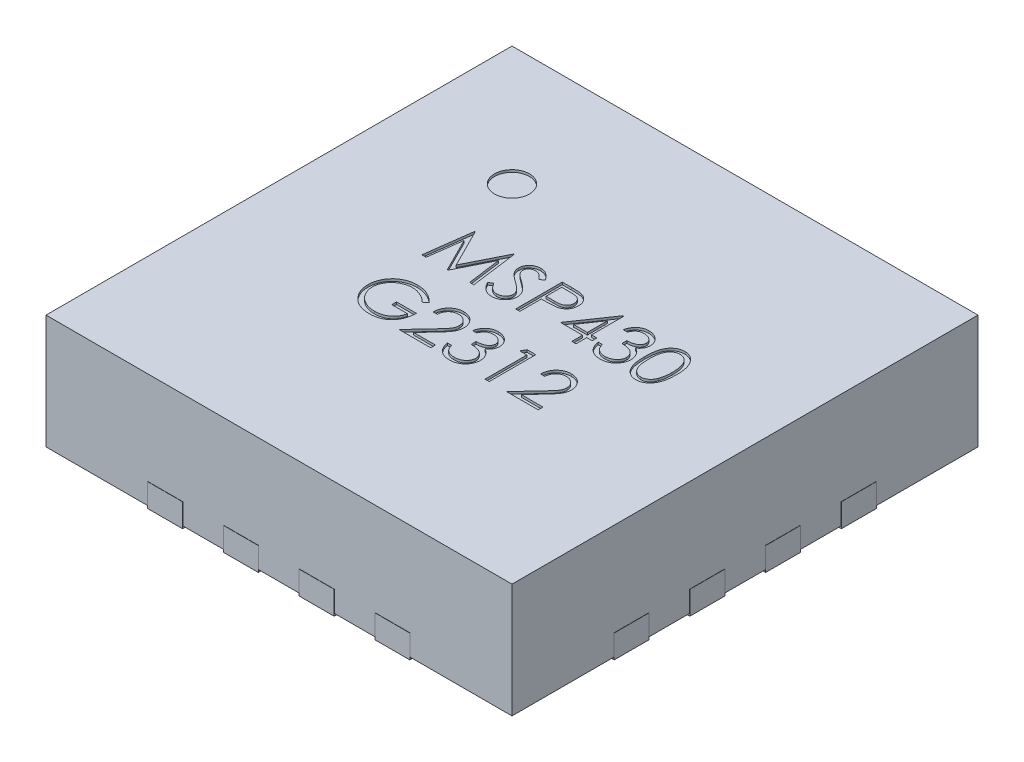
from build123d import *

# Parameters (mm, degrees)
SKETCH1_W                    = 4
SKETCH1_H                    = 4
BOSS_EXTRUDE1_DEPTH          = 0.98
BOSS_EXTRUDE2_DEPTH          = 0.02
LPATTERN2_COUNT              = 4
LPATTERN2_PITCH              = 0.65
CIRPATTERN1_COUNT            = 4
CIRPATTERN1_COPY_1_DEPTH     = 0.02
CIRPATTERN1_COPY_2_DEPTH     = 0.02
CIRPATTERN1_COPY_3_DEPTH     = 0.02
CIRPATTERN1_COPY_4_DEPTH     = 0.02
CIRPATTERN1_COPY_5_DEPTH     = 0.02
CIRPATTERN1_COPY_6_DEPTH     = 0.02
CIRPATTERN1_COPY_7_DEPTH     = 0.02
CIRPATTERN1_COPY_8_DEPTH     = 0.02
CIRPATTERN1_COPY_9_DEPTH     = 0.02
BOSS_EXTRUDE3_DEPTH          = 0.02
SKETCH5_R                    = 0.15
CUT_EXTRUDE1_DEPTH           = 0.02
CUT_EXTRUDE2_DEPTH           = 0.02
CUT_EXTRUDE3_DEPTH           = 0.02
SKETCH8_W                    = 0.3
SKETCH8_H                    = 0.2
BOSS_EXTRUDE4_DEPTH          = 0.002
LPATTERN3_COUNT              = 4
LPATTERN3_PITCH              = 0.65
CIRPATTERN2_COPY_1_SKETCH_W  = 0.3
CIRPATTERN2_COPY_1_SKETCH_H  = 0.2
CIRPATTERN2_COPY_1_DEPTH     = 0.002
CIRPATTERN2_COPY_2_SKETCH_W  = 0.3
CIRPATTERN2_COPY_2_SKETCH_H  = 0.2
CIRPATTERN2_COPY_2_DEPTH     = 0.002
CIRPATTERN2_COPY_3_SKETCH_W  = 0.3
CIRPATTERN2_COPY_3_SKETCH_H  = 0.2
CIRPATTERN2_COPY_3_DEPTH     = 0.002
CIRPATTERN2_COPY_4_SKETCH_W  = 0.3
CIRPATTERN2_COPY_4_SKETCH_H  = 0.2
CIRPATTERN2_COPY_4_DEPTH     = 0.002
CIRPATTERN2_COPY_5_SKETCH_W  = 0.3
CIRPATTERN2_COPY_5_SKETCH_H  = 0.2
CIRPATTERN2_COPY_5_DEPTH     = 0.002
CIRPATTERN2_COPY_6_SKETCH_W  = 0.3
CIRPATTERN2_COPY_6_SKETCH_H  = 0.2
CIRPATTERN2_COPY_6_DEPTH     = 0.002
CIRPATTERN2_COPY_7_SKETCH_W  = 0.3
CIRPATTERN2_COPY_7_SKETCH_H  = 0.2
CIRPATTERN2_COPY_7_DEPTH     = 0.002
CIRPATTERN2_COPY_8_SKETCH_W  = 0.3
CIRPATTERN2_COPY_8_SKETCH_H  = 0.2
CIRPATTERN2_COPY_8_DEPTH     = 0.002
CIRPATTERN2_COPY_9_SKETCH_W  = 0.3
CIRPATTERN2_COPY_9_SKETCH_H  = 0.2
CIRPATTERN2_COPY_9_DEPTH     = 0.002
CIRPATTERN2_COPY_10_SKETCH_W = 0.3
CIRPATTERN2_COPY_10_SKETCH_H = 0.2
CIRPATTERN2_COPY_10_DEPTH    = 0.002
CIRPATTERN2_COPY_11_SKETCH_W = 0.3
CIRPATTERN2_COPY_11_SKETCH_H = 0.2
CIRPATTERN2_COPY_11_DEPTH    = 0.002
CIRPATTERN2_COPY_12_SKETCH_W = 0.3
CIRPATTERN2_COPY_12_SKETCH_H = 0.2
CIRPATTERN2_COPY_12_DEPTH    = 0.002


with BuildPart() as part:
    # Sketch1 → Boss-Extrude1 (new body)
    with BuildSketch(Plane(origin=(0, 0.02, 0), x_dir=(1, 0, 0), z_dir=(0, 1, 0))):
        Rectangle(SKETCH1_W, SKETCH1_H)
    extrude(amount=BOSS_EXTRUDE1_DEPTH)

    # Sketch2 → Boss-Extrude2 (add)
    with BuildSketch(Plane.XZ.offset(-0.02)):
        with BuildLine():
            Line((1.75, -0.825), (2, -0.825))
            Line((2, -0.825), (2, -1.125))
            Line((2, -1.125), (1.75, -1.125))
            ThreePointArc((1.75, -1.125), (1.6, -0.975), (1.75, -0.825))
        make_face()
    boss_extrude2 = extrude(amount=BOSS_EXTRUDE2_DEPTH)

    # LPattern2: Boss-Extrude2 ×4
    with Locations(*[(0, 0, i * LPATTERN2_PITCH) for i in range(1, LPATTERN2_COUNT)]):
        add(boss_extrude2)

    # CirPattern1: Boss-Extrude2 ×4 about axis
    cirpattern1_axis = Axis((0, 0, 0), (0, 1, 0))
    for i in range(1, CIRPATTERN1_COUNT):
        add(boss_extrude2.rotate(cirpattern1_axis, i * 360 / CIRPATTERN1_COUNT))

    # CirPattern1 copy 1 sketch → CirPattern1 copy 1 (add)
    with BuildSketch(Plane(origin=(0.65, 0.02, 0), x_dir=(0, 0, -1), z_dir=(0, -1, 0))):
        with BuildLine():
            Line((1.75, -0.825), (2, -0.825))
            Line((2, -0.825), (2, -1.125))
            Line((2, -1.125), (1.75, -1.125))
            ThreePointArc((1.75, -1.125), (1.6, -0.975), (1.75, -0.825))
        make_face()
    extrude(amount=CIRPATTERN1_COPY_1_DEPTH)

    # CirPattern1 copy 2 sketch → CirPattern1 copy 2 (add)
    with BuildSketch(Plane(origin=(0, 0.02, -0.65), x_dir=(-1, 0, 0), z_dir=(0, -1, 0))):
        with BuildLine():
            Line((1.75, -0.825), (2, -0.825))
            Line((2, -0.825), (2, -1.125))
            Line((2, -1.125), (1.75, -1.125))
            ThreePointArc((1.75, -1.125), (1.6, -0.975), (1.75, -0.825))
        make_face()
    extrude(amount=CIRPATTERN1_COPY_2_DEPTH)

    # CirPattern1 copy 3 sketch → CirPattern1 copy 3 (add)
    with BuildSketch(Plane(origin=(-0.65, 0.02, 0), x_dir=(0, 0, 1), z_dir=(0, -1, 0))):
        with BuildLine():
            Line((1.75, -0.825), (2, -0.825))
            Line((2, -0.825), (2, -1.125))
            Line((2, -1.125), (1.75, -1.125))
            ThreePointArc((1.75, -1.125), (1.6, -0.975), (1.75, -0.825))
        make_face()
    extrude(amount=CIRPATTERN1_COPY_3_DEPTH)

    # CirPattern1 copy 4 sketch → CirPattern1 copy 4 (add)
    with BuildSketch(Plane(origin=(1.3, 0.02, 0), x_dir=(0, 0, -1), z_dir=(0, -1, 0))):
        with BuildLine():
            Line((1.75, -0.825), (2, -0.825))
            Line((2, -0.825), (2, -1.125))
            Line((2, -1.125), (1.75, -1.125))
            ThreePointArc((1.75, -1.125), (1.6, -0.975), (1.75, -0.825))
        make_face()
    extrude(amount=CIRPATTERN1_COPY_4_DEPTH)

    # CirPattern1 copy 5 sketch → CirPattern1 copy 5 (add)
    with BuildSketch(Plane(origin=(0, 0.02, -1.3), x_dir=(-1, 0, 0), z_dir=(0, -1, 0))):
        with BuildLine():
            Line((1.75, -0.825), (2, -0.825))
            Line((2, -0.825), (2, -1.125))
            Line((2, -1.125), (1.75, -1.125))
            ThreePointArc((1.75, -1.125), (1.6, -0.975), (1.75, -0.825))
        make_face()
    extrude(amount=CIRPATTERN1_COPY_5_DEPTH)

    # CirPattern1 copy 6 sketch → CirPattern1 copy 6 (add)
    with BuildSketch(Plane(origin=(-1.3, 0.02, 0), x_dir=(0, 0, 1), z_dir=(0, -1, 0))):
        with BuildLine():
            Line((1.75, -0.825), (2, -0.825))
            Line((2, -0.825), (2, -1.125))
            Line((2, -1.125), (1.75, -1.125))
            ThreePointArc((1.75, -1.125), (1.6, -0.975), (1.75, -0.825))
        make_face()
    extrude(amount=CIRPATTERN1_COPY_6_DEPTH)

    # CirPattern1 copy 7 sketch → CirPattern1 copy 7 (add)
    with BuildSketch(Plane(origin=(1.95, 0.02, 0), x_dir=(0, 0, -1), z_dir=(0, -1, 0))):
        with BuildLine():
            Line((1.75, -0.825), (2, -0.825))
            Line((2, -0.825), (2, -1.125))
            Line((2, -1.125), (1.75, -1.125))
            ThreePointArc((1.75, -1.125), (1.6, -0.975), (1.75, -0.825))
        make_face()
    extrude(amount=CIRPATTERN1_COPY_7_DEPTH)

    # CirPattern1 copy 8 sketch → CirPattern1 copy 8 (add)
    with BuildSketch(Plane(origin=(0, 0.02, -1.95), x_dir=(-1, 0, 0), z_dir=(0, -1, 0))):
        with BuildLine():
            Line((1.75, -0.825), (2, -0.825))
            Line((2, -0.825), (2, -1.125))
            Line((2, -1.125), (1.75, -1.125))
            ThreePointArc((1.75, -1.125), (1.6, -0.975), (1.75, -0.825))
        make_face()
    extrude(amount=CIRPATTERN1_COPY_8_DEPTH)

    # CirPattern1 copy 9 sketch → CirPattern1 copy 9 (add)
    with BuildSketch(Plane(origin=(-1.95, 0.02, 0), x_dir=(0, 0, 1), z_dir=(0, -1, 0))):
        with BuildLine():
            Line((1.75, -0.825), (2, -0.825))
            Line((2, -0.825), (2, -1.125))
            Line((2, -1.125), (1.75, -1.125))
            ThreePointArc((1.75, -1.125), (1.6, -0.975), (1.75, -0.825))
        make_face()
    extrude(amount=CIRPATTERN1_COPY_9_DEPTH)

    # Sketch4 → Boss-Extrude3 (add)
    with BuildSketch(Plane.XZ.offset(-0.02)):
        Polygon((-1.35, -1.05), (-1.05, -1.35), (1.35, -1.35), (1.35, 1.35), (-1.35, 1.35), align=None)
    extrude(amount=BOSS_EXTRUDE3_DEPTH)

    # Sketch5 → Cut-Extrude1 (cut)
    with BuildSketch(Plane(origin=(0, 1, 0), x_dir=(1, 0, 0), z_dir=(0, 1, 0))):
        with Locations((-0.975, 0.975)):
            Circle(SKETCH5_R)
    extrude(amount=-CUT_EXTRUDE1_DEPTH, mode=Mode.SUBTRACT)

    # Sketch7 → Cut-Extrude2 (cut)
    with BuildSketch(Plane(origin=(0, 1, 0), x_dir=(1, 0, 0), z_dir=(0, 1, 0))):
        with BuildLine():
            Line((-0.449748078, -0.260350951), (-0.480517308, -0.289517618))
            add(Edge.make_bspline(
                [(-0.480517308, -0.289517618), (-0.486085181, -0.284279805), (-0.497088158, -0.273929078), (-0.515026472, -0.26049925), (-0.533742315, -0.248994553), (-0.553138029, -0.23963384), (-0.572733293, -0.232164953), (-0.59226801, -0.226847451), (-0.611541804, -0.223456304), (-0.624360915, -0.223050776), (-0.630677565, -0.222850951)],
                knots=[0, 0, 0, 0, 1.08915593, 2.152340314, 3.188132944, 4.216796309, 5.218260357, 6.173443236, 7.099959455, 8, 8, 8, 8], degree=3))
            add(Edge.make_bspline(
                [(-0.630677565, -0.222850951), (-0.634553531, -0.222898221), (-0.64229541, -0.222992637), (-0.65379506, -0.22419769), (-0.665174105, -0.225930817), (-0.676411062, -0.22843846), (-0.68752778, -0.231616638), (-0.698485596, -0.23559212), (-0.709304951, -0.240227005), (-0.719883932, -0.245582716), (-0.730139989, -0.251466127), (-0.739826485, -0.257985961), (-0.749005159, -0.264933251), (-0.757503493, -0.272481934), (-0.765370372, -0.280563633), (-0.772793043, -0.289028011), (-0.779510448, -0.298106322), (-0.78557801, -0.307631536), (-0.790990766, -0.317436358), (-0.795768898, -0.327426414), (-0.799779994, -0.337568568), (-0.802953646, -0.347875549), (-0.805572006, -0.358267616), (-0.807414019, -0.368816727), (-0.808452501, -0.379534177), (-0.808632133, -0.386711006), (-0.808722437, -0.3903189)],
                knots=[0, 0, 0, 0, 1.02818874, 2.053710826, 3.065248034, 4.081641283, 5.106893873, 6.131558223, 7.173050175, 8.228653731, 9.27666206, 10.308777013, 11.325269123, 12.329503258, 13.32196095, 14.316845687, 15.314881793, 16.315733098, 17.311955233, 18.285320748, 19.252783886, 20.203351036, 21.145449891, 22.095197417, 23.042428769, 24, 24, 24, 24], degree=3))
            add(Edge.make_bspline(
                [(-0.808722437, -0.3903189), (-0.808636069, -0.394006994), (-0.808463569, -0.401373109), (-0.807359533, -0.412366718), (-0.805310591, -0.423197049), (-0.802571424, -0.433899693), (-0.799145045, -0.444492979), (-0.794873883, -0.45493098), (-0.789814958, -0.46521331), (-0.783959352, -0.475247324), (-0.777538071, -0.485021383), (-0.770344576, -0.494228186), (-0.762703367, -0.502990332), (-0.754336064, -0.511113276), (-0.745510973, -0.518814293), (-0.735964428, -0.52588121), (-0.725884146, -0.53245015), (-0.715254751, -0.538438323), (-0.704191576, -0.54378787), (-0.692847947, -0.548544887), (-0.681187625, -0.552462525), (-0.669271889, -0.555655452), (-0.657114944, -0.558272628), (-0.64465508, -0.55995634), (-0.631983914, -0.56117815), (-0.623442356, -0.561267483), (-0.619139103, -0.56131249)],
                knots=[0, 0, 0, 0, 0.93586088, 1.869166235, 2.799637598, 3.729985548, 4.670839027, 5.622275134, 6.589130586, 7.576015415, 8.568469353, 9.55398029, 10.53834874, 11.515998671, 12.510579167, 13.508179873, 14.527009472, 15.561807829, 16.601455013, 17.643573243, 18.680854198, 19.719860599, 20.772568776, 21.833555941, 22.908541556, 24, 24, 24, 24], degree=3))
            add(Edge.make_bspline(
                [(-0.619139103, -0.56131249), (-0.613953007, -0.561204081), (-0.603769263, -0.560991203), (-0.588799384, -0.559334027), (-0.57442189, -0.556745822), (-0.560677181, -0.552955434), (-0.547549293, -0.548120728), (-0.5349901, -0.542292684), (-0.523098481, -0.535247763), (-0.51183869, -0.527296464), (-0.50146644, -0.518437626), (-0.492111683, -0.50887826), (-0.483923627, -0.498664766), (-0.476780233, -0.487857302), (-0.470870673, -0.47636641), (-0.466020068, -0.464248403), (-0.462301977, -0.45149783), (-0.460775694, -0.442687358), (-0.460004488, -0.438235567)],
                knots=[0, 0, 0, 0, 1.13008108, 2.219097802, 3.278683437, 4.311054135, 5.322181354, 6.324827112, 7.324222904, 8.330512327, 9.32562643, 10.293043162, 11.24128371, 12.174520618, 13.111833804, 14.052305215, 15.015860969, 16, 16, 16, 16], degree=3))
            Line((-0.460004488, -0.438235567), (-0.593337821, -0.438235567))
            Line((-0.593337821, -0.438235567), (-0.593337821, -0.397209926))
            Line((-0.593337821, -0.397209926), (-0.424107052, -0.397209926))
            add(Edge.make_bspline(
                [(-0.424107052, -0.397209926), (-0.424302006, -0.404856496), (-0.424683567, -0.419822215), (-0.427360014, -0.441647389), (-0.431681901, -0.462261297), (-0.437585937, -0.481685648), (-0.445228826, -0.499892915), (-0.454528544, -0.516901586), (-0.465633929, -0.532601778), (-0.478149408, -0.547121664), (-0.492195117, -0.560073574), (-0.507391531, -0.57145711), (-0.523763756, -0.58104598), (-0.541296305, -0.588847199), (-0.559931783, -0.594935655), (-0.579713313, -0.599252407), (-0.600614067, -0.601838688), (-0.614938259, -0.602169132), (-0.622264103, -0.602338131)],
                knots=[0, 0, 0, 0, 1.140356446, 2.231883559, 3.274166699, 4.278491846, 5.25512956, 6.21435461, 7.1637429, 8.11826594, 9.068280886, 10.0076534, 10.945064095, 11.891975133, 12.864533718, 13.863980011, 14.907571808, 16, 16, 16, 16], degree=3))
            add(Edge.make_bspline(
                [(-0.622264103, -0.602338131), (-0.626779547, -0.602273089), (-0.635685458, -0.602144804), (-0.648838707, -0.601233107), (-0.661629292, -0.599829613), (-0.674055351, -0.59771017), (-0.68616259, -0.595114209), (-0.697890542, -0.591790013), (-0.709283884, -0.587942162), (-0.720360225, -0.583565513), (-0.731019031, -0.578494467), (-0.741307776, -0.572859079), (-0.751283333, -0.56668841), (-0.760877752, -0.559875742), (-0.770141023, -0.552472032), (-0.779013416, -0.544462441), (-0.787544602, -0.535871456), (-0.792888655, -0.529770998), (-0.795581411, -0.526697105)],
                knots=[0, 0, 0, 0, 1.107784379, 2.184907829, 3.233506516, 4.263428166, 5.276301166, 6.270063455, 7.25232949, 8.225834625, 9.190232166, 10.146266622, 11.1027726, 12.066435141, 13.031522626, 14.010570082, 14.99756817, 16, 16, 16, 16], degree=3))
            add(Edge.make_bspline(
                [(-0.795581411, -0.526697105), (-0.799488375, -0.521820459), (-0.80723745, -0.512148114), (-0.817212097, -0.496650978), (-0.825715114, -0.480605051), (-0.832614294, -0.463965665), (-0.838001504, -0.446748383), (-0.841865076, -0.428975207), (-0.844128766, -0.41062325), (-0.844454884, -0.398204362), (-0.844619873, -0.391921464)],
                knots=[0, 0, 0, 0, 1.023165419, 2.029347347, 3.013907458, 3.994755782, 4.975994455, 5.96558838, 6.970761222, 8, 8, 8, 8], degree=3))
            add(Edge.make_bspline(
                [(-0.844619873, -0.391921464), (-0.844559045, -0.38721675), (-0.844438164, -0.377867115), (-0.842972391, -0.363986279), (-0.840869372, -0.350351915), (-0.83777828, -0.336975165), (-0.833881564, -0.323847098), (-0.829018308, -0.310961616), (-0.823356034, -0.298311116), (-0.816774835, -0.285982674), (-0.809450896, -0.274139884), (-0.8015023, -0.262830421), (-0.792816174, -0.252260242), (-0.783534368, -0.242295482), (-0.773546141, -0.233061329), (-0.762945064, -0.224472287), (-0.751722968, -0.216516838), (-0.739844547, -0.209320285), (-0.727487097, -0.202855871), (-0.71468024, -0.197188533), (-0.701427885, -0.192504725), (-0.687829316, -0.188530579), (-0.673781601, -0.185591706), (-0.659386683, -0.183460421), (-0.644569527, -0.182002066), (-0.634553981, -0.18188478), (-0.629475642, -0.18182531)],
                knots=[0, 0, 0, 0, 1.008945113, 2.00506715, 2.99143336, 3.967273523, 4.948097931, 5.927297278, 6.919902385, 7.919676788, 8.923139349, 9.905703106, 10.883022732, 11.856032218, 12.825136022, 13.798837087, 14.781400844, 15.773989409, 16.776158564, 17.77167057, 18.775803737, 19.789618931, 20.80898985, 21.851988756, 22.910860228, 24, 24, 24, 24], degree=3))
            add(Edge.make_bspline(
                [(-0.629475642, -0.18182531), (-0.625334128, -0.181891538), (-0.617121994, -0.18202286), (-0.60490191, -0.182933105), (-0.592870708, -0.184375834), (-0.581010549, -0.18634461), (-0.569361822, -0.189026175), (-0.557891341, -0.192235121), (-0.54658248, -0.19597133), (-0.53547068, -0.200427198), (-0.524481227, -0.205484755), (-0.513553016, -0.211177718), (-0.502723388, -0.217603432), (-0.491973562, -0.224780979), (-0.481235749, -0.232587084), (-0.47067979, -0.241245007), (-0.460050882, -0.250413322), (-0.453216389, -0.257005571), (-0.449748078, -0.260350951)],
                knots=[0, 0, 0, 0, 0.985871117, 1.954866573, 2.915460327, 3.869826059, 4.81536089, 5.759505086, 6.70452669, 7.649098992, 8.607881297, 9.583363685, 10.581137262, 11.603961102, 12.659522466, 13.73993555, 14.853081303, 16, 16, 16, 16], degree=3))
        make_face()
        with BuildLine():
            Line((-0.326671155, -0.315158644), (-0.362568591, -0.315158644))
            add(Edge.make_bspline(
                [(-0.362568591, -0.315158644), (-0.36233463, -0.310396257), (-0.361875138, -0.301043055), (-0.359723334, -0.287406037), (-0.356644376, -0.274371203), (-0.352291067, -0.262043213), (-0.346884636, -0.250313063), (-0.340401204, -0.239227347), (-0.332721907, -0.228828354), (-0.324012566, -0.219212486), (-0.314553293, -0.21039105), (-0.3043469, -0.202773308), (-0.293621754, -0.196337002), (-0.282410394, -0.190956289), (-0.270586329, -0.18691745), (-0.25825686, -0.183920691), (-0.245367816, -0.18211768), (-0.236586099, -0.181923876), (-0.232119873, -0.18182531)],
                knots=[0, 0, 0, 0, 1.10065271, 2.161652631, 3.183658789, 4.190468796, 5.17591951, 6.163126047, 7.15150782, 8.156236427, 9.156009102, 10.134482811, 11.092018607, 12.041330605, 13.001268258, 13.972401359, 14.968799086, 16, 16, 16, 16], degree=3))
            add(Edge.make_bspline(
                [(-0.232119873, -0.18182531), (-0.227733807, -0.181927991), (-0.219115345, -0.182129755), (-0.206536829, -0.183862444), (-0.194562281, -0.186576226), (-0.183215108, -0.190383702), (-0.172585843, -0.195501923), (-0.162594638, -0.201650213), (-0.153122545, -0.208761051), (-0.144596056, -0.217132915), (-0.136766561, -0.22607033), (-0.130012017, -0.235611805), (-0.124227656, -0.245466581), (-0.119406207, -0.255709804), (-0.115856934, -0.266437921), (-0.113162281, -0.277494744), (-0.111639148, -0.288994723), (-0.111405386, -0.296778329), (-0.111286539, -0.300735567)],
                knots=[0, 0, 0, 0, 1.111607364, 2.184268762, 3.212621178, 4.221274766, 5.211760367, 6.196651075, 7.1921475, 8.207485113, 9.220403448, 10.201281604, 11.166441695, 12.114753415, 13.065576456, 14.026450734, 14.996634279, 16, 16, 16, 16], degree=3))
            add(Edge.make_bspline(
                [(-0.111286539, -0.300735567), (-0.111480055, -0.306306748), (-0.111863691, -0.317351344), (-0.115145334, -0.333581614), (-0.120270649, -0.349306576), (-0.126441776, -0.361962268), (-0.132667198, -0.372160381), (-0.138277199, -0.380556805), (-0.144844606, -0.38959743), (-0.152465005, -0.399251982), (-0.160980762, -0.409596086), (-0.17046901, -0.420623491), (-0.180997407, -0.432220265), (-0.18838695, -0.440140905), (-0.192216026, -0.444245182)],
                knots=[0, 0, 0, 0, 1.184426356, 2.348067706, 3.509069118, 4.696110526, 5.333549288, 6.050745305, 6.844228056, 7.710549037, 8.667450064, 9.695053472, 10.805634456, 12, 12, 12, 12], degree=3))
            Line((-0.192216026, -0.444245182), (-0.292296155, -0.55105608))
            Line((-0.292296155, -0.55105608), (-0.106158334, -0.55105608))
            Line((-0.106158334, -0.55105608), (-0.106158334, -0.592081721))
            Line((-0.106158334, -0.592081721), (-0.377953206, -0.592081721))
            Line((-0.377953206, -0.592081721), (-0.222825001, -0.426536849))
            add(Edge.make_bspline(
                [(-0.222825001, -0.426536849), (-0.219048099, -0.422594185), (-0.211793445, -0.415021135), (-0.201532579, -0.403964797), (-0.192316695, -0.393707707), (-0.184086135, -0.384269244), (-0.177019449, -0.375511351), (-0.170748337, -0.36771767), (-0.165723698, -0.360545733), (-0.16027051, -0.35223252), (-0.154988912, -0.342082541), (-0.150450357, -0.329678691), (-0.147682946, -0.316909862), (-0.147350965, -0.308281058), (-0.147183975, -0.303940695)],
                knots=[0, 0, 0, 0, 1.329631726, 2.553950428, 3.673215718, 4.687767853, 5.603093632, 6.413772471, 7.123043292, 7.734684054, 8.834405432, 9.900288307, 10.943827018, 12, 12, 12, 12], degree=3))
            add(Edge.make_bspline(
                [(-0.147183975, -0.303940695), (-0.147256631, -0.301211392), (-0.147399823, -0.295832461), (-0.14866356, -0.287946088), (-0.150573332, -0.280338681), (-0.153309933, -0.272986839), (-0.156922132, -0.265964479), (-0.161319089, -0.259263052), (-0.16639224, -0.252784314), (-0.172260956, -0.246709651), (-0.178707987, -0.241146085), (-0.185518758, -0.236217618), (-0.192724484, -0.232098862), (-0.200294784, -0.228722462), (-0.208208552, -0.226073847), (-0.216481094, -0.224238581), (-0.225089553, -0.223086297), (-0.230967667, -0.222930392), (-0.233962821, -0.222850951)],
                knots=[0, 0, 0, 0, 0.991446411, 1.95395049, 2.89581595, 3.838931463, 4.798493298, 5.75982156, 6.748411868, 7.785213223, 8.824556874, 9.840280684, 10.836137867, 11.835679398, 12.848801643, 13.863922112, 14.911575587, 16, 16, 16, 16], degree=3))
            add(Edge.make_bspline(
                [(-0.233962821, -0.222850951), (-0.237090916, -0.222932669), (-0.243233979, -0.22309315), (-0.252253297, -0.22421574), (-0.260857386, -0.226152408), (-0.269067889, -0.22880117), (-0.276898699, -0.232167862), (-0.284311732, -0.236361204), (-0.291290348, -0.241365032), (-0.297847665, -0.247038238), (-0.303889263, -0.253354536), (-0.309197477, -0.260395674), (-0.31383565, -0.268033093), (-0.31788242, -0.276246185), (-0.321168784, -0.285109474), (-0.323680002, -0.294591497), (-0.32566707, -0.304651084), (-0.326330901, -0.31159795), (-0.326671155, -0.315158644)],
                knots=[0, 0, 0, 0, 1.031018746, 2.02475058, 2.990194455, 3.934040569, 4.864654155, 5.795059489, 6.735614925, 7.690564532, 8.649604399, 9.611025574, 10.590972636, 11.591080095, 12.624614302, 13.701020113, 14.821632451, 16, 16, 16, 16], degree=3))
        make_face()
        with BuildLine():
            Line((-0.018978847, -0.284389413), (-0.054876283, -0.284389413))
            add(Edge.make_bspline(
                [(-0.054876283, -0.284389413), (-0.053903763, -0.280362843), (-0.052002566, -0.272491229), (-0.048037129, -0.261244685), (-0.043717214, -0.250601997), (-0.038529887, -0.240762446), (-0.032871744, -0.231528285), (-0.026389147, -0.223108957), (-0.019381179, -0.215290332), (-0.011629756, -0.208351676), (-0.003500766, -0.202068507), (0.005120333, -0.196711358), (0.014060092, -0.192102883), (0.02338045, -0.188306285), (0.033109156, -0.185446226), (0.043158255, -0.183371162), (0.053554084, -0.182023606), (0.060610952, -0.18189209), (0.06419423, -0.18182531)],
                knots=[0, 0, 0, 0, 1.162005537, 2.271625781, 3.343758855, 4.383309926, 5.390229558, 6.379919256, 7.361854164, 8.333198761, 9.295911338, 10.242430842, 11.177959212, 12.116337295, 13.062827104, 14.020064771, 14.994644689, 16, 16, 16, 16], degree=3))
            add(Edge.make_bspline(
                [(0.06419423, -0.18182531), (0.069415115, -0.181982937), (0.079743002, -0.182294751), (0.094915921, -0.185142115), (0.109547558, -0.189647845), (0.123477758, -0.195873413), (0.136417007, -0.203551964), (0.147929714, -0.212690791), (0.15785983, -0.223113568), (0.166190616, -0.234625861), (0.172713473, -0.246929348), (0.177523344, -0.259592223), (0.180451536, -0.272584448), (0.180831028, -0.281356709), (0.181021153, -0.285751592)],
                knots=[0, 0, 0, 0, 1.083050992, 2.142477498, 3.193116406, 4.255571735, 5.30263384, 6.308962982, 7.297363603, 8.282367274, 9.249857812, 10.179914175, 11.08814088, 12, 12, 12, 12], degree=3))
            add(Edge.make_bspline(
                [(0.181021153, -0.285751592), (0.180888171, -0.28998094), (0.180627946, -0.298257118), (0.17841838, -0.310339575), (0.17469995, -0.321727186), (0.16954912, -0.332467891), (0.162881514, -0.342493587), (0.154804635, -0.351826831), (0.145261473, -0.360509021), (0.138029595, -0.365482675), (0.134306409, -0.368043259)],
                knots=[0, 0, 0, 0, 1.024540389, 2.004866551, 2.965041327, 3.920577974, 4.882998113, 5.874504559, 6.905732034, 8, 8, 8, 8], degree=3))
            add(Edge.make_bspline(
                [(0.134306409, -0.368043259), (0.138561467, -0.370097907), (0.146991967, -0.37416876), (0.158483456, -0.382152275), (0.168915213, -0.391370143), (0.174732781, -0.398563589), (0.177655768, -0.402177875)],
                knots=[0, 0, 0, 0, 1.015518401, 2.012035669, 3.001164323, 4, 4, 4, 4], degree=3))
            add(Edge.make_bspline(
                [(0.177655768, -0.402177875), (0.179580493, -0.404813046), (0.183398424, -0.410040237), (0.188111057, -0.4184444), (0.192386384, -0.426941713), (0.195717838, -0.43575993), (0.198297708, -0.444796846), (0.200141826, -0.454067977), (0.201287442, -0.463580894), (0.201451505, -0.470016606), (0.201533974, -0.473251592)],
                knots=[0, 0, 0, 0, 1.025084078, 2.033381695, 3.024893161, 4.013698104, 4.991890475, 5.976764909, 6.982997093, 8, 8, 8, 8], degree=3))
            add(Edge.make_bspline(
                [(0.201533974, -0.473251592), (0.201328886, -0.478852703), (0.200919677, -0.490028567), (0.197262068, -0.506539963), (0.191591984, -0.522680021), (0.183539763, -0.538117145), (0.173726333, -0.552560617), (0.16205121, -0.565483624), (0.148647049, -0.576592036), (0.133697832, -0.585873205), (0.117501589, -0.593292396), (0.100178664, -0.598441818), (0.081978658, -0.601795647), (0.069497824, -0.602155289), (0.063152563, -0.602338131)],
                knots=[0, 0, 0, 0, 0.955779014, 1.907060117, 2.875433937, 3.871313158, 4.872415639, 5.851225146, 6.836215519, 7.83643374, 8.849228613, 9.86973379, 10.916971861, 12, 12, 12, 12], degree=3))
            add(Edge.make_bspline(
                [(0.063152563, -0.602338131), (0.058876072, -0.602238907), (0.050461363, -0.602043666), (0.038090677, -0.600708969), (0.026282483, -0.598271254), (0.015020815, -0.594990876), (0.004295668, -0.59083182), (-0.00586023, -0.58565254), (-0.015509361, -0.579559797), (-0.02456067, -0.572481673), (-0.033013077, -0.564563805), (-0.04064196, -0.555665633), (-0.047574508, -0.545951644), (-0.053625095, -0.535309009), (-0.059069318, -0.523875265), (-0.063547142, -0.511504008), (-0.06748835, -0.498305834), (-0.069320746, -0.489108378), (-0.070260898, -0.484389413)],
                knots=[0, 0, 0, 0, 1.048658725, 2.063410685, 3.046034179, 4.001477787, 4.936774919, 5.862367409, 6.792675028, 7.730719943, 8.675894397, 9.627829632, 10.600096036, 11.597688215, 12.626045268, 13.701542398, 14.82072376, 16, 16, 16, 16], degree=3))
            Line((-0.070260898, -0.484389413), (-0.034363462, -0.484389413))
            add(Edge.make_bspline(
                [(-0.034363462, -0.484389413), (-0.033428229, -0.4874693), (-0.031609119, -0.493459948), (-0.028512628, -0.502081698), (-0.024984825, -0.509985475), (-0.021200304, -0.517229261), (-0.017225625, -0.523884392), (-0.012778205, -0.529774892), (-0.008187445, -0.535159486), (-0.004726948, -0.538193156), (-0.003033334, -0.539677875)],
                knots=[0, 0, 0, 0, 1.198163088, 2.33053128, 3.407730985, 4.417276592, 5.372219308, 6.28897303, 7.162600585, 8, 8, 8, 8], degree=3))
            add(Edge.make_bspline(
                [(-0.003033334, -0.539677875), (-0.000793725, -0.541404541), (0.003678579, -0.544852545), (0.010966377, -0.549252731), (0.018630935, -0.55306542), (0.026838327, -0.555977842), (0.035411443, -0.55844386), (0.044488856, -0.560057634), (0.053990481, -0.561164854), (0.060478226, -0.56126256), (0.063793589, -0.56131249)],
                knots=[0, 0, 0, 0, 0.946170439, 1.889420265, 2.845303464, 3.807233317, 4.801018734, 5.828864929, 6.890507805, 8, 8, 8, 8], degree=3))
            add(Edge.make_bspline(
                [(0.063793589, -0.56131249), (0.067536846, -0.561242101), (0.074856463, -0.561104461), (0.085537019, -0.559838666), (0.09569787, -0.55799519), (0.105226204, -0.555147992), (0.114246833, -0.55163018), (0.122633308, -0.54721322), (0.13049572, -0.542030966), (0.137733366, -0.536140776), (0.144241424, -0.529692605), (0.149971654, -0.522948254), (0.154843044, -0.51593616), (0.158772596, -0.508617517), (0.161875516, -0.501022634), (0.163987882, -0.493130196), (0.165456626, -0.485004794), (0.165576239, -0.479481484), (0.165636538, -0.476697105)],
                knots=[0, 0, 0, 0, 1.217147791, 2.380027433, 3.494444702, 4.572153297, 5.609568379, 6.639424714, 7.649109417, 8.668170816, 9.669597737, 10.625200337, 11.543417969, 12.441394052, 13.322311151, 14.205496177, 15.095365482, 16, 16, 16, 16], degree=3))
            add(Edge.make_bspline(
                [(0.165636538, -0.476697105), (0.165461646, -0.472970095), (0.165112733, -0.46553462), (0.162448895, -0.454595469), (0.158067311, -0.44405565), (0.15193331, -0.434094988), (0.144466369, -0.424863457), (0.135738951, -0.416626716), (0.125678582, -0.409830134), (0.116419169, -0.405134288), (0.108217437, -0.40193005), (0.101198536, -0.399795769), (0.093340638, -0.397988494), (0.08473877, -0.396307091), (0.075328116, -0.39487608), (0.065118923, -0.39368273), (0.054109122, -0.392727868), (0.046487274, -0.392301457), (0.042559615, -0.392081721)],
                knots=[0, 0, 0, 0, 1.07054697, 2.135767047, 3.216561865, 4.33974944, 5.486079747, 6.621378074, 7.775625952, 8.963672916, 9.598146892, 10.304877434, 11.070270905, 11.915000392, 12.823868403, 13.805723172, 14.86925407, 16, 16, 16, 16], degree=3))
            Line((0.042559615, -0.392081721), (0.042559615, -0.35105608))
            add(Edge.make_bspline(
                [(0.042559615, -0.35105608), (0.047508319, -0.350972102), (0.057201616, -0.350807611), (0.071360965, -0.348818124), (0.084900772, -0.346066052), (0.097520971, -0.341850601), (0.109023681, -0.336954568), (0.119003064, -0.331257172), (0.12731931, -0.324924058), (0.133932004, -0.317857474), (0.138906773, -0.310278611), (0.142544121, -0.302379565), (0.14469273, -0.294091101), (0.144979549, -0.288434567), (0.145123717, -0.285591336)],
                knots=[0, 0, 0, 0, 1.321986639, 2.589447074, 3.816329219, 5.01088745, 6.139805852, 7.153945165, 8.075214402, 8.924034688, 9.728124013, 10.488707548, 11.240355623, 12, 12, 12, 12], degree=3))
            add(Edge.make_bspline(
                [(0.145123717, -0.285591336), (0.145076356, -0.283502451), (0.144982133, -0.279346713), (0.143793873, -0.273275277), (0.142008268, -0.267389454), (0.139553442, -0.261714276), (0.136267705, -0.256289102), (0.132335592, -0.251067679), (0.127653523, -0.246079818), (0.122288329, -0.241430639), (0.11652698, -0.236999869), (0.11021272, -0.233238311), (0.103535935, -0.230021732), (0.096489231, -0.227369218), (0.089049742, -0.22537387), (0.081252421, -0.223941203), (0.0730824, -0.223045471), (0.067508488, -0.222916509), (0.064674999, -0.222850951)],
                knots=[0, 0, 0, 0, 0.884392785, 1.759457502, 2.611959086, 3.489218968, 4.37281399, 5.2945488, 6.255912374, 7.266815255, 8.301784654, 9.332968512, 10.37626691, 11.440494194, 12.520033166, 13.637162961, 14.798855837, 16, 16, 16, 16], degree=3))
            add(Edge.make_bspline(
                [(0.064674999, -0.222850951), (0.060120523, -0.223009964), (0.051224571, -0.223320553), (0.038400009, -0.226040898), (0.0264778, -0.23038125), (0.017364809, -0.235562167), (0.010635372, -0.240676502), (0.005826579, -0.24514306), (0.001104235, -0.250106812), (-0.003220985, -0.255873483), (-0.007595154, -0.262052545), (-0.011577389, -0.268958108), (-0.015447068, -0.276410039), (-0.017778788, -0.281678112), (-0.018978847, -0.284389413)],
                knots=[0, 0, 0, 0, 1.472543308, 2.876219568, 4.221790263, 5.565193594, 6.249813518, 6.953379497, 7.687249741, 8.463570142, 9.283606569, 10.136032583, 11.040678096, 12, 12, 12, 12], degree=3))
        make_face()
        Polygon((0.322447435, -0.192081721), (0.396405768, -0.192081721), (0.396405768, -0.592081721), (0.360508333, -0.592081721), (0.360508333, -0.233107362), (0.298969871, -0.233107362), align=None)
        with BuildLine():
            Line((0.596405768, -0.315158644), (0.560508333, -0.315158644))
            add(Edge.make_bspline(
                [(0.560508333, -0.315158644), (0.560742293, -0.310396257), (0.561201785, -0.301043055), (0.563353589, -0.287406037), (0.566432547, -0.274371203), (0.570785856, -0.262043213), (0.576192287, -0.250313063), (0.582675719, -0.239227347), (0.590355016, -0.228828354), (0.599064357, -0.219212486), (0.60852363, -0.21039105), (0.618730023, -0.202773308), (0.629455169, -0.196337002), (0.640666529, -0.190956289), (0.652490594, -0.18691745), (0.664820063, -0.183920691), (0.677709107, -0.18211768), (0.686490824, -0.181923876), (0.69095705, -0.18182531)],
                knots=[0, 0, 0, 0, 1.10065271, 2.161652631, 3.183658789, 4.190468796, 5.17591951, 6.163126047, 7.15150782, 8.156236427, 9.156009102, 10.134482811, 11.092018607, 12.041330605, 13.001268258, 13.972401359, 14.968799086, 16, 16, 16, 16], degree=3))
            add(Edge.make_bspline(
                [(0.69095705, -0.18182531), (0.695343116, -0.181927991), (0.703961578, -0.182129755), (0.716540094, -0.183862444), (0.728514642, -0.186576226), (0.739861816, -0.190383702), (0.75049108, -0.195501923), (0.760482285, -0.201650213), (0.769954378, -0.208761051), (0.778480867, -0.217132915), (0.786310362, -0.22607033), (0.793064906, -0.235611805), (0.798849267, -0.245466581), (0.803670716, -0.255709804), (0.807219989, -0.266437921), (0.809914642, -0.277494744), (0.811437775, -0.288994723), (0.811671537, -0.296778329), (0.811790384, -0.300735567)],
                knots=[0, 0, 0, 0, 1.111607364, 2.184268762, 3.212621178, 4.221274766, 5.211760367, 6.196651075, 7.1921475, 8.207485113, 9.220403448, 10.201281604, 11.166441695, 12.114753415, 13.065576456, 14.026450734, 14.996634279, 16, 16, 16, 16], degree=3))
            add(Edge.make_bspline(
                [(0.811790384, -0.300735567), (0.811596868, -0.306306748), (0.811213232, -0.317351344), (0.807931589, -0.333581614), (0.802806274, -0.349306576), (0.796635147, -0.361962268), (0.790409725, -0.372160381), (0.784799724, -0.380556805), (0.778232317, -0.38959743), (0.770611918, -0.399251982), (0.762096161, -0.409596086), (0.752607914, -0.420623491), (0.742079516, -0.432220265), (0.734689973, -0.440140905), (0.730860897, -0.444245182)],
                knots=[0, 0, 0, 0, 1.184426356, 2.348067706, 3.509069118, 4.696110526, 5.333549288, 6.050745305, 6.844228056, 7.710549037, 8.667450064, 9.695053472, 10.805634456, 12, 12, 12, 12], degree=3))
            Line((0.730860897, -0.444245182), (0.630780768, -0.55105608))
            Line((0.630780768, -0.55105608), (0.816918589, -0.55105608))
            Line((0.816918589, -0.55105608), (0.816918589, -0.592081721))
            Line((0.816918589, -0.592081721), (0.545123717, -0.592081721))
            Line((0.545123717, -0.592081721), (0.700251922, -0.426536849))
            add(Edge.make_bspline(
                [(0.700251922, -0.426536849), (0.704028824, -0.422594185), (0.711283478, -0.415021135), (0.721544344, -0.403964797), (0.730760228, -0.393707707), (0.738990788, -0.384269244), (0.746057474, -0.375511351), (0.752328586, -0.36771767), (0.757353225, -0.360545733), (0.762806413, -0.35223252), (0.768088011, -0.342082541), (0.772626566, -0.329678691), (0.775393977, -0.316909862), (0.775725959, -0.308281058), (0.775892948, -0.303940695)],
                knots=[0, 0, 0, 0, 1.329631726, 2.553950428, 3.673215718, 4.687767853, 5.603093632, 6.413772471, 7.123043292, 7.734684054, 8.834405432, 9.900288307, 10.943827018, 12, 12, 12, 12], degree=3))
            add(Edge.make_bspline(
                [(0.775892948, -0.303940695), (0.775820292, -0.301211392), (0.7756771, -0.295832461), (0.774413363, -0.287946088), (0.772503591, -0.280338681), (0.76976699, -0.272986839), (0.766154791, -0.265964479), (0.761757834, -0.259263052), (0.756684684, -0.252784314), (0.750815967, -0.246709651), (0.744368936, -0.241146085), (0.737558165, -0.236217618), (0.730352439, -0.232098862), (0.722782139, -0.228722462), (0.714868371, -0.226073847), (0.706595829, -0.224238581), (0.69798737, -0.223086297), (0.692109256, -0.222930392), (0.689114102, -0.222850951)],
                knots=[0, 0, 0, 0, 0.991446411, 1.95395049, 2.89581595, 3.838931463, 4.798493298, 5.75982156, 6.748411868, 7.785213223, 8.824556874, 9.840280684, 10.836137867, 11.835679398, 12.848801643, 13.863922112, 14.911575587, 16, 16, 16, 16], degree=3))
            add(Edge.make_bspline(
                [(0.689114102, -0.222850951), (0.685986007, -0.222932669), (0.679842944, -0.22309315), (0.670823626, -0.22421574), (0.662219537, -0.226152408), (0.654009034, -0.22880117), (0.646178224, -0.232167862), (0.638765191, -0.236361204), (0.631786575, -0.241365032), (0.625229258, -0.247038238), (0.61918766, -0.253354536), (0.613879446, -0.260395674), (0.609241273, -0.268033093), (0.605194503, -0.276246185), (0.601908139, -0.285109474), (0.599396921, -0.294591497), (0.597409853, -0.304651084), (0.596746022, -0.31159795), (0.596405768, -0.315158644)],
                knots=[0, 0, 0, 0, 1.031018746, 2.02475058, 2.990194455, 3.934040569, 4.864654155, 5.795059489, 6.735614925, 7.690564532, 8.649604399, 9.611025574, 10.590972636, 11.591080095, 12.624614302, 13.701020113, 14.821632451, 16, 16, 16, 16], degree=3))
        make_face()
    extrude(amount=-CUT_EXTRUDE2_DEPTH, mode=Mode.SUBTRACT)

    # Sketch6 → Cut-Extrude3 (cut)
    # profile 1 of 6: a face of its own
    with BuildSketch(Plane(origin=(0, 1, 0), x_dir=(1, 0, 0), z_dir=(0, 1, 0))):
        Polygon((-0.834902237, 0.061223361), (-0.78209775, 0.461223361), (-0.776969544, 0.461223361), (-0.611825314, 0.133018233), (-0.447081724, 0.461223361), (-0.441873391, 0.461223361), (-0.388748391, 0.061223361), (-0.424806083, 0.061223361), (-0.463107365, 0.349043874), (-0.607498391, 0.061223361), (-0.615591339, 0.061223361), (-0.760543262, 0.3496849), (-0.798764416, 0.061223361), align=None)
    # profile 2 of 6: a face of its own
    with BuildSketch(Plane(origin=(0, 1, 0), x_dir=(1, 0, 0), z_dir=(0, 1, 0))):
        with BuildLine():
            Line((-0.34772275, 0.138386823), (-0.313908647, 0.158659259))
            add(Edge.make_bspline(
                [(-0.313908647, 0.158659259), (-0.310763706, 0.153394758), (-0.304738119, 0.143308177), (-0.294686535, 0.129678686), (-0.284271345, 0.11809444), (-0.273415422, 0.108622828), (-0.262185028, 0.101165812), (-0.25050685, 0.095885557), (-0.238420243, 0.092592302), (-0.230194663, 0.092192293), (-0.226088134, 0.091992592)],
                knots=[0, 0, 0, 0, 1.272034388, 2.437168799, 3.508375237, 4.49857839, 5.41946034, 6.295179144, 7.148887113, 8, 8, 8, 8], degree=3))
            add(Edge.make_bspline(
                [(-0.226088134, 0.091992592), (-0.222581064, 0.092090269), (-0.21562829, 0.092283914), (-0.205392605, 0.094144577), (-0.195451828, 0.097003106), (-0.186010841, 0.101096926), (-0.177199913, 0.106049896), (-0.169473434, 0.112032317), (-0.162793878, 0.118730169), (-0.157329979, 0.126202472), (-0.153137975, 0.134238718), (-0.149916025, 0.142487398), (-0.148128016, 0.151078091), (-0.147858673, 0.156862144), (-0.14772275, 0.159781054)],
                knots=[0, 0, 0, 0, 1.095163259, 2.171163733, 3.241058638, 4.321873601, 5.38011039, 6.391990106, 7.366004449, 8.327778327, 9.272591725, 10.192022065, 11.087607919, 12, 12, 12, 12], degree=3))
            add(Edge.make_bspline(
                [(-0.14772275, 0.159781054), (-0.147891242, 0.163111436), (-0.148233763, 0.169881618), (-0.151128789, 0.17987015), (-0.155682989, 0.189755015), (-0.159884434, 0.195869445), (-0.162065698, 0.199043874)],
                knots=[0, 0, 0, 0, 0.938893495, 1.908633276, 2.914225137, 4, 4, 4, 4], degree=3))
            add(Edge.make_bspline(
                [(-0.162065698, 0.199043874), (-0.163856626, 0.20133494), (-0.167616454, 0.206144745), (-0.174080169, 0.213304201), (-0.181664868, 0.220689163), (-0.190110989, 0.228581627), (-0.199726199, 0.236614518), (-0.210209343, 0.245170892), (-0.22182807, 0.253925358), (-0.229976584, 0.259796509), (-0.234181083, 0.262825925)],
                knots=[0, 0, 0, 0, 0.722233717, 1.516239348, 2.393582979, 3.351407094, 4.387010283, 5.505090956, 6.712668013, 8, 8, 8, 8], degree=3))
            add(Edge.make_bspline(
                [(-0.234181083, 0.262825925), (-0.23838954, 0.265823478), (-0.246435788, 0.271554571), (-0.257688198, 0.280060204), (-0.267750422, 0.287836646), (-0.276577738, 0.294957104), (-0.284166264, 0.301422545), (-0.290575796, 0.307170881), (-0.29564306, 0.312357573), (-0.298460841, 0.315722298), (-0.299725955, 0.317232977)],
                knots=[0, 0, 0, 0, 1.452282411, 2.77665338, 3.964542531, 5.026858415, 5.96415736, 6.766646006, 7.446254459, 8, 8, 8, 8], degree=3))
            add(Edge.make_bspline(
                [(-0.299725955, 0.317232977), (-0.301494246, 0.319587381), (-0.304971827, 0.324217633), (-0.309562228, 0.331454759), (-0.313463846, 0.338863133), (-0.316522398, 0.34646266), (-0.319097966, 0.354146652), (-0.320830301, 0.362015366), (-0.321915032, 0.370033493), (-0.322026116, 0.375429322), (-0.322081724, 0.378130413)],
                knots=[0, 0, 0, 0, 1.068054152, 2.10047183, 3.106115577, 4.101338837, 5.06977816, 6.043150881, 7.020423561, 8, 8, 8, 8], degree=3))
            add(Edge.make_bspline(
                [(-0.322081724, 0.378130413), (-0.321932557, 0.382362387), (-0.321637412, 0.39073588), (-0.319141353, 0.402967975), (-0.315201594, 0.414646422), (-0.309682178, 0.425655603), (-0.302567052, 0.435708858), (-0.294333226, 0.444921828), (-0.284526199, 0.452666809), (-0.273765899, 0.459433902), (-0.261988028, 0.464730579), (-0.249646211, 0.468726119), (-0.236720831, 0.470990034), (-0.227966187, 0.471314922), (-0.223524032, 0.471479772)],
                knots=[0, 0, 0, 0, 1.005424448, 1.989358655, 2.955360095, 3.929531133, 4.905563448, 5.876582895, 6.856512386, 7.866279853, 8.892233794, 9.918561126, 10.94386622, 12, 12, 12, 12], degree=3))
            add(Edge.make_bspline(
                [(-0.223524032, 0.471479772), (-0.21881042, 0.471317194), (-0.209436551, 0.47099388), (-0.19564807, 0.468182733), (-0.182372559, 0.463531228), (-0.171693329, 0.458252524), (-0.163335299, 0.452980363), (-0.156961272, 0.448178097), (-0.150502135, 0.442649513), (-0.143905786, 0.436379885), (-0.137283996, 0.429311685), (-0.130538459, 0.42149332), (-0.1236534, 0.412972571), (-0.119224159, 0.406889771), (-0.116953519, 0.403771438)],
                knots=[0, 0, 0, 0, 1.286793592, 2.559021753, 3.825965368, 5.121522368, 5.803751409, 6.523245864, 7.299691795, 8.125521123, 9.008227632, 9.944561021, 10.946284179, 12, 12, 12, 12], degree=3))
            Line((-0.116953519, 0.403771438), (-0.149405442, 0.379172079))
            add(Edge.make_bspline(
                [(-0.149405442, 0.379172079), (-0.151364977, 0.381696501), (-0.155138584, 0.386557947), (-0.160867668, 0.393366097), (-0.166267513, 0.399585124), (-0.171587559, 0.404986853), (-0.176546831, 0.409867096), (-0.181360207, 0.414045354), (-0.185958419, 0.417562565), (-0.191754637, 0.421316115), (-0.199036662, 0.425036858), (-0.208177752, 0.428185324), (-0.217730469, 0.430077331), (-0.224236713, 0.43032749), (-0.227530442, 0.430454131)],
                knots=[0, 0, 0, 0, 1.181633172, 2.275549214, 3.290209073, 4.226197932, 5.078386478, 5.862611352, 6.581680152, 7.217281963, 8.414376989, 9.595101626, 10.782541182, 12, 12, 12, 12], degree=3))
            add(Edge.make_bspline(
                [(-0.227530442, 0.430454131), (-0.231662616, 0.430315651), (-0.239631124, 0.430048605), (-0.250944294, 0.427132035), (-0.261126457, 0.422539823), (-0.269875321, 0.416103825), (-0.277159547, 0.408478569), (-0.282428743, 0.399703842), (-0.28560019, 0.390014425), (-0.285987193, 0.383255379), (-0.286184288, 0.379813105)],
                knots=[0, 0, 0, 0, 1.14458467, 2.207223713, 3.21896685, 4.227309161, 5.202851033, 6.127160689, 7.046193047, 8, 8, 8, 8], degree=3))
            add(Edge.make_bspline(
                [(-0.286184288, 0.379813105), (-0.286139359, 0.377670079), (-0.286049428, 0.373380522), (-0.284795166, 0.367043217), (-0.283183814, 0.360721921), (-0.28063037, 0.354445054), (-0.277105193, 0.348102842), (-0.27247603, 0.341586072), (-0.266645937, 0.334837305), (-0.262179993, 0.330447891), (-0.259822109, 0.328130413)],
                knots=[0, 0, 0, 0, 0.858281714, 1.717966888, 2.583508476, 3.4729293, 4.427298488, 5.488583878, 6.674047936, 8, 8, 8, 8], degree=3))
            add(Edge.make_bspline(
                [(-0.259822109, 0.328130413), (-0.258946523, 0.327349038), (-0.256866333, 0.325492672), (-0.25306337, 0.322453554), (-0.248041336, 0.318704666), (-0.24193137, 0.314066115), (-0.234620814, 0.308685377), (-0.226108865, 0.302631249), (-0.216490404, 0.295707197), (-0.209665042, 0.290866335), (-0.206056083, 0.288306695)],
                knots=[0, 0, 0, 0, 0.420754252, 0.999615792, 1.744751191, 2.668019286, 3.750313428, 4.999500688, 6.413464383, 8, 8, 8, 8], degree=3))
            add(Edge.make_bspline(
                [(-0.206056083, 0.288306695), (-0.201714836, 0.285147682), (-0.193308612, 0.279030692), (-0.181347746, 0.269840329), (-0.170502739, 0.260852012), (-0.160735516, 0.252123143), (-0.151949583, 0.243719932), (-0.144242415, 0.235541283), (-0.13753548, 0.227645789), (-0.130314998, 0.217523209), (-0.122936962, 0.205091085), (-0.11660079, 0.189859286), (-0.11260555, 0.174568278), (-0.112083091, 0.164290926), (-0.111825314, 0.159220156)],
                knots=[0, 0, 0, 0, 1.163667725, 2.253281268, 3.268753668, 4.215851969, 5.092017293, 5.902905408, 6.650798638, 7.335211899, 8.59617414, 9.77448103, 10.901945474, 12, 12, 12, 12], degree=3))
            add(Edge.make_bspline(
                [(-0.111825314, 0.159220156), (-0.111900415, 0.155634057), (-0.11204916, 0.148531499), (-0.113758978, 0.138102348), (-0.116264083, 0.127973105), (-0.120039767, 0.118268978), (-0.124648128, 0.108812434), (-0.130495699, 0.099851531), (-0.13727372, 0.091187943), (-0.145049008, 0.083052686), (-0.153557111, 0.07558455), (-0.162549533, 0.068941228), (-0.172040993, 0.063401991), (-0.18198, 0.058881895), (-0.192368839, 0.055346636), (-0.203204014, 0.052785165), (-0.214503387, 0.051213084), (-0.222183442, 0.051049911), (-0.226088134, 0.050966951)],
                knots=[0, 0, 0, 0, 0.983748083, 1.948392443, 2.894712957, 3.844097841, 4.80183111, 5.778335162, 6.776009319, 7.81870978, 8.863265674, 9.881300176, 10.883814829, 11.87499822, 12.874611388, 13.892143829, 14.928324115, 16, 16, 16, 16], degree=3))
            add(Edge.make_bspline(
                [(-0.226088134, 0.050966951), (-0.229109316, 0.051025372), (-0.235113632, 0.051141478), (-0.243994715, 0.05216791), (-0.252696383, 0.05362015), (-0.261109443, 0.055925758), (-0.26934229, 0.058723127), (-0.277359117, 0.062167508), (-0.285163809, 0.066295188), (-0.292800104, 0.071014619), (-0.300248581, 0.076506933), (-0.307439378, 0.082903904), (-0.314608428, 0.090029105), (-0.32154413, 0.098076026), (-0.328386775, 0.106914664), (-0.33500145, 0.116627714), (-0.341525075, 0.127162268), (-0.345618272, 0.134575421), (-0.34772275, 0.138386823)],
                knots=[0, 0, 0, 0, 0.915332311, 1.819136955, 2.706846663, 3.586547465, 4.459518054, 5.340707479, 6.227863349, 7.133153174, 8.059268498, 9.028702269, 10.047606654, 11.120612155, 12.245963614, 13.433783089, 14.680604001, 16, 16, 16, 16], degree=3))
        make_face()
    # profile 3 of 6: a face of its own
    with BuildSketch(Plane(origin=(0, 1, 0), x_dir=(1, 0, 0), z_dir=(0, 1, 0))):
        with BuildLine():
            Line((-0.029774032, 0.461223361), (0.048671481, 0.461223361))
            add(Edge.make_bspline(
                [(0.048671481, 0.461223361), (0.054067013, 0.46121743), (0.064405093, 0.461206066), (0.07922967, 0.460861524), (0.09269364, 0.460401331), (0.104767969, 0.4597634), (0.115489809, 0.459009504), (0.124810643, 0.457952128), (0.132803735, 0.456848094), (0.137593044, 0.455725648), (0.13977725, 0.455213746)],
                knots=[0, 0, 0, 0, 1.415646017, 2.712440637, 3.8905458, 4.950247383, 5.884950622, 6.709939814, 7.411656543, 8, 8, 8, 8], degree=3))
            add(Edge.make_bspline(
                [(0.13977725, 0.455213746), (0.142542226, 0.454456952), (0.148007023, 0.452961196), (0.155881428, 0.449965342), (0.163373296, 0.446413095), (0.170508331, 0.442364644), (0.177198855, 0.437646294), (0.183544688, 0.432449309), (0.189489829, 0.426653701), (0.195000845, 0.420324474), (0.200061965, 0.413567878), (0.204419643, 0.406283052), (0.208068469, 0.398592618), (0.211197986, 0.390501924), (0.21345038, 0.38194303), (0.215147169, 0.372975405), (0.216224155, 0.363600012), (0.216327305, 0.35719317), (0.216379815, 0.353931695)],
                knots=[0, 0, 0, 0, 0.999701418, 1.975846123, 2.934577507, 3.890451536, 4.834027766, 5.787354733, 6.749476667, 7.726910423, 8.712836071, 9.690891519, 10.682875813, 11.679750201, 12.712814741, 13.765529915, 14.8625177, 16, 16, 16, 16], degree=3))
            add(Edge.make_bspline(
                [(0.216379815, 0.353931695), (0.216331652, 0.350642806), (0.216237418, 0.344207873), (0.215106414, 0.33479384), (0.213582963, 0.325797452), (0.211240443, 0.317238658), (0.208172366, 0.309168284), (0.204573274, 0.301463001), (0.2002323, 0.294253895), (0.195244319, 0.287514796), (0.189695565, 0.281239378), (0.183609515, 0.275473115), (0.177010739, 0.270249762), (0.169920208, 0.265557609), (0.162268797, 0.261505463), (0.15417255, 0.257876056), (0.145561097, 0.254827935), (0.139601953, 0.2532245), (0.136572122, 0.252409259)],
                knots=[0, 0, 0, 0, 1.121902311, 2.195077645, 3.232258892, 4.234102512, 5.217864754, 6.176164875, 7.132989551, 8.084763148, 9.034132444, 9.988522005, 10.94243251, 11.903244335, 12.886203696, 13.894208494, 14.929344452, 16, 16, 16, 16], degree=3))
            add(Edge.make_bspline(
                [(0.136572122, 0.252409259), (0.134066141, 0.251876347), (0.128574138, 0.250708439), (0.119529256, 0.249404615), (0.108998354, 0.248291746), (0.096995808, 0.247457331), (0.08353239, 0.246743003), (0.068600818, 0.246175221), (0.052171781, 0.245863237), (0.04071221, 0.245847147), (0.034729174, 0.245838746)],
                knots=[0, 0, 0, 0, 0.601384939, 1.31797006, 2.144135048, 3.087295005, 4.142315834, 5.309527816, 6.595305764, 8, 8, 8, 8], degree=3))
            Line((0.034729174, 0.245838746), (0.006123404, 0.245838746))
            Line((0.006123404, 0.245838746), (0.006123404, 0.061223361))
            Line((0.006123404, 0.061223361), (-0.029774032, 0.061223361))
            Line((-0.029774032, 0.061223361), (-0.029774032, 0.461223361))
        make_face()
        with BuildLine():
            Line((0.006123404, 0.42019772), (0.006123404, 0.286864387))
            Line((0.006123404, 0.286864387), (0.076155456, 0.285982977))
            add(Edge.make_bspline(
                [(0.076155456, 0.285982977), (0.079574876, 0.285981209), (0.086175996, 0.285977798), (0.095711564, 0.286433252), (0.10455834, 0.286959027), (0.112689148, 0.287728847), (0.120107655, 0.288816991), (0.12682623, 0.289915475), (0.132792777, 0.291504659), (0.139775542, 0.293644439), (0.147556496, 0.29729388), (0.156021359, 0.302591011), (0.16319514, 0.309343092), (0.169402946, 0.316934844), (0.174329332, 0.325380459), (0.177935731, 0.334416908), (0.18005472, 0.34395152), (0.180338857, 0.350475879), (0.180482379, 0.353771438)],
                knots=[0, 0, 0, 0, 1.160613943, 2.240541288, 3.23993089, 4.169200891, 5.011653406, 5.7853311, 6.478053781, 7.106038997, 8.262395093, 9.384106736, 10.481365981, 11.59014053, 12.70357646, 13.786202915, 14.881775077, 16, 16, 16, 16], degree=3))
            add(Edge.make_bspline(
                [(0.180482379, 0.353771438), (0.180338076, 0.356987268), (0.180051221, 0.363379941), (0.177919122, 0.372748942), (0.174336343, 0.381690165), (0.169369875, 0.390029946), (0.163342318, 0.397594381), (0.156336679, 0.404165481), (0.148369449, 0.409447962), (0.140958222, 0.41285748), (0.13437523, 0.414939225), (0.128657291, 0.416395779), (0.122201214, 0.417558705), (0.115004897, 0.418500362), (0.107124116, 0.419306472), (0.098491165, 0.419853441), (0.089138749, 0.420173608), (0.082646112, 0.420189488), (0.079280456, 0.42019772)],
                knots=[0, 0, 0, 0, 1.120700087, 2.227813068, 3.331159281, 4.466773991, 5.599788987, 6.693661531, 7.80175334, 8.91857717, 9.525282508, 10.207424825, 10.974604443, 11.810962634, 12.737642355, 13.736264703, 14.826523623, 16, 16, 16, 16], degree=3))
            Line((0.079280456, 0.42019772), (0.006123404, 0.42019772))
        make_face(mode=Mode.SUBTRACT)
    # profile 4 of 6: a face of its own
    with BuildSketch(Plane(origin=(0, 1, 0), x_dir=(1, 0, 0), z_dir=(0, 1, 0))):
        Polygon((0.48088302, 0.471479772), (0.488174686, 0.471479772), (0.488174686, 0.194556695), (0.534328533, 0.194556695), (0.534328533, 0.153531054), (0.488174686, 0.153531054), (0.488174686, 0.061223361), (0.45227725, 0.061223361), (0.45227725, 0.153531054), (0.262533661, 0.153531054), align=None)
        Polygon((0.45227725, 0.194556695), (0.45227725, 0.368274643), (0.333046481, 0.194556695), align=None, mode=Mode.SUBTRACT)
    # profile 5 of 6: a face of its own
    with BuildSketch(Plane(origin=(0, 1, 0), x_dir=(1, 0, 0), z_dir=(0, 1, 0))):
        with BuildLine():
            Line((0.62150802, 0.368915669), (0.585610584, 0.368915669))
            add(Edge.make_bspline(
                [(0.585610584, 0.368915669), (0.586583104, 0.372942239), (0.588484301, 0.380813853), (0.592449738, 0.392060397), (0.596769653, 0.402703085), (0.601956979, 0.412542636), (0.607615123, 0.421776797), (0.614097719, 0.430196125), (0.621105688, 0.43801475), (0.62885711, 0.444953406), (0.6369861, 0.451236575), (0.6456072, 0.456593724), (0.654546959, 0.461202199), (0.663867317, 0.464998797), (0.673596022, 0.467858856), (0.683645122, 0.46993392), (0.694040951, 0.471281476), (0.701097818, 0.471412992), (0.704681097, 0.471479772)],
                knots=[0, 0, 0, 0, 1.162005537, 2.271625781, 3.343758855, 4.383309926, 5.390229558, 6.379919256, 7.361854164, 8.333198761, 9.295911338, 10.242430842, 11.177959212, 12.116337295, 13.062827104, 14.020064771, 14.994644689, 16, 16, 16, 16], degree=3))
            add(Edge.make_bspline(
                [(0.704681097, 0.471479772), (0.709901981, 0.471322145), (0.720229868, 0.471010331), (0.735402788, 0.468162967), (0.750034425, 0.463657237), (0.763964624, 0.457431669), (0.776903874, 0.449753118), (0.788416581, 0.440614291), (0.798346696, 0.430191514), (0.806677482, 0.418679221), (0.813200339, 0.406375734), (0.818010211, 0.393712859), (0.820938403, 0.380720634), (0.821317895, 0.371948373), (0.82150802, 0.36755349)],
                knots=[0, 0, 0, 0, 1.083050992, 2.142477498, 3.193116406, 4.255571735, 5.30263384, 6.308962982, 7.297363603, 8.282367274, 9.249857812, 10.179914175, 11.08814088, 12, 12, 12, 12], degree=3))
            add(Edge.make_bspline(
                [(0.82150802, 0.36755349), (0.821375038, 0.363324142), (0.821114813, 0.355047964), (0.818905247, 0.342965507), (0.815186817, 0.331577896), (0.810035987, 0.320837191), (0.803368381, 0.310811495), (0.795291501, 0.301478251), (0.78574834, 0.292796061), (0.778516461, 0.287822407), (0.774793276, 0.285261823)],
                knots=[0, 0, 0, 0, 1.024540389, 2.004866551, 2.965041327, 3.920577974, 4.882998113, 5.874504559, 6.905732034, 8, 8, 8, 8], degree=3))
            add(Edge.make_bspline(
                [(0.774793276, 0.285261823), (0.779048334, 0.283207175), (0.787478834, 0.279136322), (0.798970323, 0.271152807), (0.80940208, 0.261934939), (0.815219648, 0.254741493), (0.818142635, 0.251127207)],
                knots=[0, 0, 0, 0, 1.015518401, 2.012035669, 3.001164323, 4, 4, 4, 4], degree=3))
            add(Edge.make_bspline(
                [(0.818142635, 0.251127207), (0.82006736, 0.248492036), (0.823885291, 0.243264845), (0.828597923, 0.234860682), (0.832873251, 0.226363369), (0.836204704, 0.217545152), (0.838784575, 0.208508236), (0.840628693, 0.199237105), (0.841774309, 0.189724188), (0.841938372, 0.183288476), (0.84202084, 0.18005349)],
                knots=[0, 0, 0, 0, 1.025084078, 2.033381695, 3.024893161, 4.013698104, 4.991890475, 5.976764909, 6.982997093, 8, 8, 8, 8], degree=3))
            add(Edge.make_bspline(
                [(0.84202084, 0.18005349), (0.841815753, 0.174452379), (0.841406544, 0.163276515), (0.837748935, 0.146765119), (0.83207885, 0.130625061), (0.824026629, 0.115187937), (0.8142132, 0.100744465), (0.802538077, 0.087821458), (0.789133916, 0.076713046), (0.774184699, 0.067431877), (0.757988456, 0.060012686), (0.740665531, 0.054863264), (0.722465525, 0.051509435), (0.709984691, 0.051149793), (0.70363943, 0.050966951)],
                knots=[0, 0, 0, 0, 0.955779014, 1.907060117, 2.875433937, 3.871313158, 4.872415639, 5.851225146, 6.836215519, 7.83643374, 8.849228613, 9.86973379, 10.916971861, 12, 12, 12, 12], degree=3))
            add(Edge.make_bspline(
                [(0.70363943, 0.050966951), (0.699362938, 0.051066175), (0.690948229, 0.051261416), (0.678577544, 0.052596113), (0.66676935, 0.055033828), (0.655507681, 0.058314206), (0.644782534, 0.062473262), (0.634626637, 0.067652542), (0.624977506, 0.073745285), (0.615926197, 0.080823409), (0.607473789, 0.088741277), (0.599844907, 0.097639449), (0.592912359, 0.107353438), (0.586861772, 0.117996073), (0.581417548, 0.129429817), (0.576939725, 0.141801074), (0.572998517, 0.154999248), (0.571166121, 0.164196704), (0.570225968, 0.168915669)],
                knots=[0, 0, 0, 0, 1.048658725, 2.063410685, 3.046034179, 4.001477787, 4.936774919, 5.862367409, 6.792675028, 7.730719943, 8.675894397, 9.627829632, 10.600096036, 11.597688215, 12.626045268, 13.701542398, 14.82072376, 16, 16, 16, 16], degree=3))
            Line((0.570225968, 0.168915669), (0.606123404, 0.168915669))
            add(Edge.make_bspline(
                [(0.606123404, 0.168915669), (0.607058638, 0.165835782), (0.608877748, 0.159845134), (0.611974239, 0.151223384), (0.615502041, 0.143319607), (0.619286562, 0.136075822), (0.623261242, 0.12942069), (0.627708662, 0.12353019), (0.632299421, 0.118145596), (0.635759919, 0.115111926), (0.637453533, 0.113627207)],
                knots=[0, 0, 0, 0, 1.198163088, 2.33053128, 3.407730985, 4.417276592, 5.372219308, 6.28897303, 7.162600585, 8, 8, 8, 8], degree=3))
            add(Edge.make_bspline(
                [(0.637453533, 0.113627207), (0.639693141, 0.111900541), (0.644165446, 0.108452537), (0.651453243, 0.104052351), (0.659117802, 0.100239662), (0.667325193, 0.09732724), (0.67589831, 0.094861222), (0.684975723, 0.093247448), (0.694477348, 0.092140228), (0.700965092, 0.092042522), (0.704280456, 0.091992592)],
                knots=[0, 0, 0, 0, 0.946170439, 1.889420265, 2.845303464, 3.807233317, 4.801018734, 5.828864929, 6.890507805, 8, 8, 8, 8], degree=3))
            add(Edge.make_bspline(
                [(0.704280456, 0.091992592), (0.708023713, 0.092062981), (0.71534333, 0.092200621), (0.726023885, 0.093466416), (0.736184736, 0.095309892), (0.745713071, 0.09815709), (0.7547337, 0.101674902), (0.763120174, 0.106091862), (0.770982587, 0.111274116), (0.778220233, 0.117164306), (0.784728291, 0.123612477), (0.790458521, 0.130356828), (0.795329911, 0.137368922), (0.799259463, 0.144687565), (0.802362383, 0.152282448), (0.804474748, 0.160174886), (0.805943493, 0.168300288), (0.806063106, 0.173823598), (0.806123404, 0.176607977)],
                knots=[0, 0, 0, 0, 1.217147791, 2.380027433, 3.494444702, 4.572153297, 5.609568379, 6.639424714, 7.649109417, 8.668170816, 9.669597737, 10.625200337, 11.543417969, 12.441394052, 13.322311151, 14.205496177, 15.095365482, 16, 16, 16, 16], degree=3))
            add(Edge.make_bspline(
                [(0.806123404, 0.176607977), (0.805948513, 0.180334987), (0.8055996, 0.187770462), (0.802935762, 0.198709613), (0.798554178, 0.209249432), (0.792420176, 0.219210094), (0.784953236, 0.228441625), (0.776225818, 0.236678366), (0.766165449, 0.243474948), (0.756906035, 0.248170794), (0.748704303, 0.251375032), (0.741685402, 0.253509313), (0.733827505, 0.255316588), (0.725225636, 0.256997991), (0.715814983, 0.258429002), (0.70560579, 0.259622352), (0.694595989, 0.260577214), (0.686974141, 0.261003625), (0.683046481, 0.261223361)],
                knots=[0, 0, 0, 0, 1.07054697, 2.135767047, 3.216561865, 4.33974944, 5.486079747, 6.621378074, 7.775625952, 8.963672916, 9.598146892, 10.304877434, 11.070270905, 11.915000392, 12.823868403, 13.805723172, 14.86925407, 16, 16, 16, 16], degree=3))
            Line((0.683046481, 0.261223361), (0.683046481, 0.302249002))
            add(Edge.make_bspline(
                [(0.683046481, 0.302249002), (0.687995186, 0.30233298), (0.697688483, 0.302497471), (0.711847832, 0.304486958), (0.725387639, 0.30723903), (0.738007838, 0.311454481), (0.749510548, 0.316350515), (0.759489931, 0.32204791), (0.767806177, 0.328381024), (0.77441887, 0.335447608), (0.779393639, 0.343026471), (0.783030988, 0.350925517), (0.785179596, 0.359213981), (0.785466415, 0.364870515), (0.785610584, 0.367713746)],
                knots=[0, 0, 0, 0, 1.321986639, 2.589447074, 3.816329219, 5.01088745, 6.139805852, 7.153945165, 8.075214402, 8.924034688, 9.728124013, 10.488707548, 11.240355623, 12, 12, 12, 12], degree=3))
            add(Edge.make_bspline(
                [(0.785610584, 0.367713746), (0.785563223, 0.369802631), (0.785469, 0.373958369), (0.784280739, 0.380029805), (0.782495135, 0.385915628), (0.780040308, 0.391590806), (0.776754571, 0.39701598), (0.772822459, 0.402237403), (0.76814039, 0.407225264), (0.762775196, 0.411874443), (0.757013847, 0.416305213), (0.750699587, 0.420066771), (0.744022801, 0.42328335), (0.736976098, 0.425935864), (0.729536609, 0.427931212), (0.721739288, 0.429363879), (0.713569267, 0.430259611), (0.707995355, 0.430388573), (0.705161866, 0.430454131)],
                knots=[0, 0, 0, 0, 0.884392785, 1.759457502, 2.611959086, 3.489218968, 4.37281399, 5.2945488, 6.255912374, 7.266815255, 8.301784654, 9.332968512, 10.37626691, 11.440494194, 12.520033166, 13.637162961, 14.798855837, 16, 16, 16, 16], degree=3))
            add(Edge.make_bspline(
                [(0.705161866, 0.430454131), (0.70060739, 0.430295118), (0.691711438, 0.429984529), (0.678886876, 0.427264184), (0.666964666, 0.422923832), (0.657851676, 0.417742915), (0.651122239, 0.41262858), (0.646313446, 0.408162022), (0.641591102, 0.40319827), (0.637265882, 0.397431599), (0.632891713, 0.391252537), (0.628909477, 0.384346974), (0.625039798, 0.376895043), (0.622708078, 0.37162697), (0.62150802, 0.368915669)],
                knots=[0, 0, 0, 0, 1.472543308, 2.876219568, 4.221790263, 5.565193594, 6.249813518, 6.953379497, 7.687249741, 8.463570142, 9.283606569, 10.136032583, 11.040678096, 12, 12, 12, 12], degree=3))
        make_face()
    # profile 6 of 6: a face of its own
    with BuildSketch(Plane(origin=(0, 1, 0), x_dir=(1, 0, 0), z_dir=(0, 1, 0))):
        with BuildLine():
            add(Edge.make_bspline(
                [(0.877918276, 0.261063105), (0.877955764, 0.267474235), (0.878028584, 0.279927947), (0.87883869, 0.298074764), (0.880184443, 0.315098797), (0.882028714, 0.331000861), (0.884273055, 0.345785063), (0.887269111, 0.359411892), (0.890676288, 0.371944419), (0.894625139, 0.38342351), (0.899080886, 0.394003819), (0.903930516, 0.403880985), (0.909366493, 0.413040063), (0.91507814, 0.421627239), (0.921296662, 0.429501947), (0.927845095, 0.436775394), (0.934979024, 0.44327948), (0.942455939, 0.449204772), (0.950343535, 0.454398997), (0.958416983, 0.458974167), (0.966731852, 0.462882723), (0.975310844, 0.465955916), (0.984076851, 0.468494298), (0.993060516, 0.470230178), (1.002276672, 0.471322396), (1.008497407, 0.471426815), (1.01165225, 0.471479772)],
                knots=[0, 0, 0, 0, 1.646270934, 3.197905019, 4.663502075, 6.030701355, 7.308322542, 8.50163776, 9.611534131, 10.641858119, 11.616356847, 12.558055219, 13.465016945, 14.349605745, 15.204443733, 16.039544428, 16.859896111, 17.680448484, 18.487036065, 19.28249412, 20.06191084, 20.843045899, 21.620316918, 22.403196591, 23.190181807, 24, 24, 24, 24], degree=3))
            add(Edge.make_bspline(
                [(1.01165225, 0.471479772), (1.014833448, 0.471424021), (1.021159849, 0.471313151), (1.030513035, 0.470247558), (1.039650141, 0.46847943), (1.048532214, 0.465974175), (1.057232213, 0.462866098), (1.065682088, 0.458970428), (1.073934326, 0.4544357), (1.081857787, 0.449107257), (1.089539458, 0.443166425), (1.096790653, 0.436450692), (1.103612035, 0.429027867), (1.110089212, 0.420977368), (1.116038423, 0.412144787), (1.121703959, 0.402683746), (1.126775048, 0.39242879), (1.131659011, 0.381551022), (1.135874667, 0.369749461), (1.139676523, 0.357090631), (1.142748406, 0.34342501), (1.14530718, 0.328824296), (1.147289453, 0.313234869), (1.148733184, 0.296690148), (1.149495822, 0.279179246), (1.149639445, 0.26720692), (1.149713148, 0.261063105)],
                knots=[0, 0, 0, 0, 0.810914788, 1.612654377, 2.396697861, 3.181598691, 3.963628158, 4.749916497, 5.551656086, 6.361998678, 7.18212741, 8.025565596, 8.878627764, 9.750805457, 10.657531673, 11.591944965, 12.560506719, 13.57287815, 14.630710178, 15.753379473, 16.941251878, 18.199788006, 19.531962791, 20.947069417, 22.433333509, 24, 24, 24, 24], degree=3))
            add(Edge.make_bspline(
                [(1.149713148, 0.261063105), (1.149638681, 0.254946087), (1.149493586, 0.243027327), (1.148741733, 0.225595215), (1.147260747, 0.209138296), (1.145408177, 0.1936171), (1.142842353, 0.17909623), (1.139687476, 0.165525435), (1.136184582, 0.152846113), (1.131860606, 0.141162134), (1.127127953, 0.130310509), (1.121978788, 0.120177121), (1.116462236, 0.110672401), (1.110452094, 0.10187243), (1.10404599, 0.09371487), (1.097106814, 0.086343713), (1.089830176, 0.07958135), (1.0821259, 0.073564021), (1.074078865, 0.068297187), (1.065854971, 0.063587032), (1.057308298, 0.05978901), (1.048632532, 0.056527862), (1.039703576, 0.054036382), (1.03053256, 0.052313656), (1.021166133, 0.051105445), (1.014834526, 0.051013275), (1.01165225, 0.050966951)],
                knots=[0, 0, 0, 0, 1.561518951, 3.042555995, 4.452378317, 5.7783523, 7.031515105, 8.214008947, 9.334062868, 10.386615937, 11.391082383, 12.354592575, 13.286541444, 14.194233754, 15.072674879, 15.931287219, 16.775624067, 17.606195743, 18.42308326, 19.229000347, 20.022332153, 20.807536673, 21.593273796, 22.3848459, 23.188221202, 24, 24, 24, 24], degree=3))
            add(Edge.make_bspline(
                [(1.01165225, 0.050966951), (1.008497495, 0.051020249), (1.002276932, 0.051125342), (0.993059512, 0.052212625), (0.984112947, 0.053960683), (0.975393089, 0.056408295), (0.966855202, 0.059404276), (0.958615626, 0.063307554), (0.950582748, 0.067802876), (0.942777999, 0.072922353), (0.935348037, 0.078787688), (0.928251054, 0.085275035), (0.921665337, 0.092546282), (0.915535727, 0.100486617), (0.909710116, 0.109022987), (0.904351331, 0.118271944), (0.899394662, 0.128196814), (0.894863977, 0.138861718), (0.890846987, 0.150422281), (0.887298678, 0.163010759), (0.88449706, 0.17673826), (0.882099008, 0.19149453), (0.880164792, 0.20734298), (0.878844298, 0.224292211), (0.878028148, 0.242331664), (0.877955568, 0.254705352), (0.877918276, 0.261063105)],
                knots=[0, 0, 0, 0, 0.810891512, 1.598919785, 2.382837074, 3.152667961, 3.926044502, 4.706494248, 5.493654104, 6.291793342, 7.103789334, 7.925228297, 8.761435821, 9.622817696, 10.50288917, 11.416980706, 12.369136599, 13.353924996, 14.394355917, 15.514179734, 16.714354668, 17.994756427, 19.357759367, 20.818452758, 22.365282078, 24, 24, 24, 24], degree=3))
        make_face()
        with BuildLine():
            add(Edge.make_bspline(
                [(0.913815712, 0.261223361), (0.913829363, 0.255880653), (0.913855857, 0.245511505), (0.914547994, 0.230443704), (0.915490878, 0.216389952), (0.916707026, 0.203332405), (0.918513078, 0.19131526), (0.92053671, 0.180255868), (0.922999349, 0.170212755), (0.925913066, 0.161117006), (0.92923182, 0.152814255), (0.932855347, 0.145088402), (0.936748001, 0.13784818), (0.941104475, 0.131158625), (0.945849054, 0.124997921), (0.950874569, 0.119257026), (0.956368579, 0.114137371), (0.963969007, 0.107997159), (0.974002889, 0.101652115), (0.986645227, 0.096126847), (0.999635907, 0.092654567), (1.008453193, 0.092212994), (1.012854174, 0.091992592)],
                knots=[0, 0, 0, 0, 1.459021318, 2.831673884, 4.118529203, 5.306027144, 6.411944654, 7.436330062, 8.375795394, 9.233974572, 10.042671642, 10.816086306, 11.563610507, 12.285937304, 12.993564865, 13.685989202, 14.367179055, 15.041617293, 16.353048772, 17.594441528, 18.799311195, 20, 20, 20, 20], degree=3))
            add(Edge.make_bspline(
                [(1.012854174, 0.091992592), (1.017283622, 0.092175196), (1.026133373, 0.092540026), (1.03906295, 0.096059881), (1.05161498, 0.101370686), (1.061451774, 0.107650401), (1.068935493, 0.113630781), (1.074297435, 0.118729598), (1.079218812, 0.12443884), (1.083886477, 0.13059876), (1.088167514, 0.137327044), (1.092060444, 0.144591338), (1.095612827, 0.152411815), (1.097636718, 0.157871214), (1.098671481, 0.160662464)],
                knots=[0, 0, 0, 0, 1.353760809, 2.704726607, 4.075137775, 5.516104923, 6.260822281, 7.007110065, 7.778089737, 8.566572457, 9.372053459, 10.217411131, 11.088608312, 12, 12, 12, 12], degree=3))
            add(Edge.make_bspline(
                [(1.098671481, 0.160662464), (1.099877398, 0.164231577), (1.102325925, 0.171478407), (1.105481556, 0.182719967), (1.107966745, 0.194514569), (1.110202558, 0.206791725), (1.111728621, 0.219641977), (1.112956943, 0.233025563), (1.11368045, 0.246952576), (1.113770136, 0.256414861), (1.113815712, 0.261223361)],
                knots=[0, 0, 0, 0, 0.884706709, 1.796334032, 2.740027952, 3.714592787, 4.726048262, 5.777819803, 6.87074269, 8, 8, 8, 8], degree=3))
            add(Edge.make_bspline(
                [(1.113815712, 0.261223361), (1.113752833, 0.266031084), (1.113629829, 0.275436017), (1.113159659, 0.289209523), (1.111945536, 0.302291553), (1.110597065, 0.314738464), (1.108608812, 0.326481356), (1.106465062, 0.337618534), (1.103584924, 0.348012022), (1.100508378, 0.357824546), (1.09698719, 0.366944621), (1.093111106, 0.375414768), (1.088971476, 0.383275879), (1.08447522, 0.390506387), (1.079675714, 0.397138677), (1.074446279, 0.403039774), (1.068994351, 0.40839257), (1.061358101, 0.414502578), (1.05136104, 0.420732486), (1.038921537, 0.426465716), (1.025976321, 0.429758092), (1.017225069, 0.430222285), (1.012854174, 0.430454131)],
                knots=[0, 0, 0, 0, 1.31362396, 2.569729283, 3.763502607, 4.902122613, 5.988968491, 7.01645872, 7.998833611, 8.933434873, 9.825090667, 10.667526885, 11.477055099, 12.250526234, 12.991942729, 13.710640831, 14.402115721, 15.076753259, 16.378508321, 17.609869233, 18.806226677, 20, 20, 20, 20], degree=3))
            add(Edge.make_bspline(
                [(1.012854174, 0.430454131), (1.008430106, 0.430221965), (0.999573911, 0.429757212), (0.986494145, 0.426477983), (0.973956505, 0.420762215), (0.963985879, 0.414481944), (0.956344303, 0.408500423), (0.950963424, 0.403313399), (0.945918147, 0.397639542), (0.94127041, 0.39142218), (0.936917349, 0.384740424), (0.932919519, 0.377541708), (0.929317539, 0.369789552), (0.925993592, 0.361490531), (0.923070987, 0.352395566), (0.920660249, 0.342364823), (0.918433157, 0.331340607), (0.916856555, 0.319258378), (0.915454983, 0.30619756), (0.914554257, 0.292108724), (0.913853542, 0.277015652), (0.913828575, 0.266592891), (0.913815712, 0.261223361)],
                knots=[0, 0, 0, 0, 1.207732386, 2.417664972, 3.655092373, 4.956220595, 5.625982001, 6.301752483, 6.994047911, 7.697131622, 8.419323945, 9.170223765, 9.943494443, 10.752040957, 11.610060368, 12.549350801, 13.567764191, 14.679664412, 15.874934091, 17.154273443, 18.533957287, 20, 20, 20, 20], degree=3))
        make_face(mode=Mode.SUBTRACT)
    extrude(amount=-CUT_EXTRUDE3_DEPTH, mode=Mode.SUBTRACT)

    # Sketch8 → Boss-Extrude4 (add)
    with BuildSketch(Plane.ZY.offset(2)):
        with Locations((-0.975, 0.1)):
            Rectangle(SKETCH8_W, SKETCH8_H)
    boss_extrude4 = extrude(amount=BOSS_EXTRUDE4_DEPTH)

    # LPattern3: Boss-Extrude4 ×4
    with Locations(*[(0, 0, i * LPATTERN3_PITCH) for i in range(1, LPATTERN3_COUNT)]):
        add(boss_extrude4)

    # CirPattern2 copy 1 sketch → CirPattern2 copy 1 (add)
    with BuildSketch(Plane(origin=(0.65, 0, 2), x_dir=(1, 0, 0), z_dir=(0, 0, 1))):
        with Locations((-0.975, 0.1)):
            Rectangle(CIRPATTERN2_COPY_1_SKETCH_W, CIRPATTERN2_COPY_1_SKETCH_H)
    extrude(amount=CIRPATTERN2_COPY_1_DEPTH)

    # CirPattern2 copy 2 sketch → CirPattern2 copy 2 (add)
    with BuildSketch(Plane(origin=(2, 0, -0.65), x_dir=(0, 0, -1), z_dir=(1, 0, 0))):
        with Locations((-0.975, 0.1)):
            Rectangle(CIRPATTERN2_COPY_2_SKETCH_W, CIRPATTERN2_COPY_2_SKETCH_H)
    extrude(amount=CIRPATTERN2_COPY_2_DEPTH)

    # CirPattern2 copy 3 sketch → CirPattern2 copy 3 (add)
    with BuildSketch(Plane(origin=(-0.65, 0, -2), x_dir=(-1, 0, 0), z_dir=(0, 0, -1))):
        with Locations((-0.975, 0.1)):
            Rectangle(CIRPATTERN2_COPY_3_SKETCH_W, CIRPATTERN2_COPY_3_SKETCH_H)
    extrude(amount=CIRPATTERN2_COPY_3_DEPTH)

    # CirPattern2 copy 4 sketch → CirPattern2 copy 4 (add)
    with BuildSketch(Plane(origin=(1.3, 0, 2), x_dir=(1, 0, 0), z_dir=(0, 0, 1))):
        with Locations((-0.975, 0.1)):
            Rectangle(CIRPATTERN2_COPY_4_SKETCH_W, CIRPATTERN2_COPY_4_SKETCH_H)
    extrude(amount=CIRPATTERN2_COPY_4_DEPTH)

    # CirPattern2 copy 5 sketch → CirPattern2 copy 5 (add)
    with BuildSketch(Plane(origin=(2, 0, -1.3), x_dir=(0, 0, -1), z_dir=(1, 0, 0))):
        with Locations((-0.975, 0.1)):
            Rectangle(CIRPATTERN2_COPY_5_SKETCH_W, CIRPATTERN2_COPY_5_SKETCH_H)
    extrude(amount=CIRPATTERN2_COPY_5_DEPTH)

    # CirPattern2 copy 6 sketch → CirPattern2 copy 6 (add)
    with BuildSketch(Plane(origin=(-1.3, 0, -2), x_dir=(-1, 0, 0), z_dir=(0, 0, -1))):
        with Locations((-0.975, 0.1)):
            Rectangle(CIRPATTERN2_COPY_6_SKETCH_W, CIRPATTERN2_COPY_6_SKETCH_H)
    extrude(amount=CIRPATTERN2_COPY_6_DEPTH)

    # CirPattern2 copy 7 sketch → CirPattern2 copy 7 (add)
    with BuildSketch(Plane(origin=(1.95, 0, 2), x_dir=(1, 0, 0), z_dir=(0, 0, 1))):
        with Locations((-0.975, 0.1)):
            Rectangle(CIRPATTERN2_COPY_7_SKETCH_W, CIRPATTERN2_COPY_7_SKETCH_H)
    extrude(amount=CIRPATTERN2_COPY_7_DEPTH)

    # CirPattern2 copy 8 sketch → CirPattern2 copy 8 (add)
    with BuildSketch(Plane(origin=(2, 0, -1.95), x_dir=(0, 0, -1), z_dir=(1, 0, 0))):
        with Locations((-0.975, 0.1)):
            Rectangle(CIRPATTERN2_COPY_8_SKETCH_W, CIRPATTERN2_COPY_8_SKETCH_H)
    extrude(amount=CIRPATTERN2_COPY_8_DEPTH)

    # CirPattern2 copy 9 sketch → CirPattern2 copy 9 (add)
    with BuildSketch(Plane(origin=(-1.95, 0, -2), x_dir=(-1, 0, 0), z_dir=(0, 0, -1))):
        with Locations((-0.975, 0.1)):
            Rectangle(CIRPATTERN2_COPY_9_SKETCH_W, CIRPATTERN2_COPY_9_SKETCH_H)
    extrude(amount=CIRPATTERN2_COPY_9_DEPTH)

    # CirPattern2 copy 10 sketch → CirPattern2 copy 10 (add)
    with BuildSketch(Plane.XY.offset(2)):
        with Locations((-0.975, 0.1)):
            Rectangle(CIRPATTERN2_COPY_10_SKETCH_W, CIRPATTERN2_COPY_10_SKETCH_H)
    extrude(amount=CIRPATTERN2_COPY_10_DEPTH)

    # CirPattern2 copy 11 sketch → CirPattern2 copy 11 (add)
    with BuildSketch(Plane(origin=(2, 0, 0), x_dir=(0, 0, -1), z_dir=(1, 0, 0))):
        with Locations((-0.975, 0.1)):
            Rectangle(CIRPATTERN2_COPY_11_SKETCH_W, CIRPATTERN2_COPY_11_SKETCH_H)
    extrude(amount=CIRPATTERN2_COPY_11_DEPTH)

    # CirPattern2 copy 12 sketch → CirPattern2 copy 12 (add)
    with BuildSketch(Plane(origin=(0, 0, -2), x_dir=(-1, 0, 0), z_dir=(0, 0, -1))):
        with Locations((-0.975, 0.1)):
            Rectangle(CIRPATTERN2_COPY_12_SKETCH_W, CIRPATTERN2_COPY_12_SKETCH_H)
    extrude(amount=CIRPATTERN2_COPY_12_DEPTH)


solid = part.part
